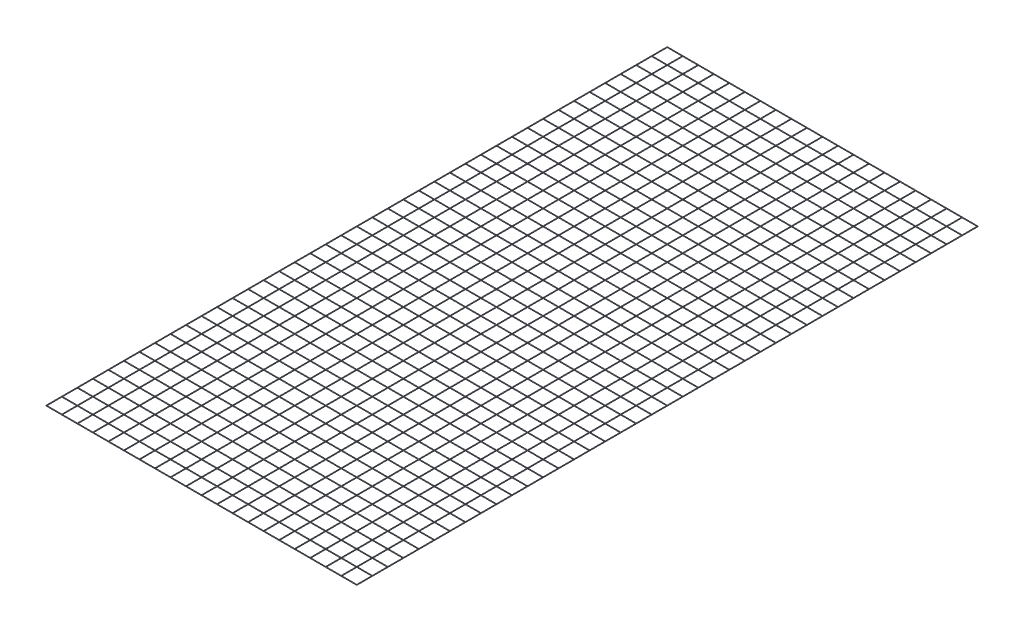
from build123d import *

# Parameters (mm, degrees)
SCHIZZO1_R                      = 1
ESTRUSIONE_ESTRUSIONE1_DEPTH    = 2000
ESTRUSIONE_ESTRUSIONE1_2_DEPTH  = 2000
ESTRUSIONE_ESTRUSIONE1_3_DEPTH  = 2000
ESTRUSIONE_ESTRUSIONE1_4_DEPTH  = 2000
ESTRUSIONE_ESTRUSIONE1_5_DEPTH  = 2000
ESTRUSIONE_ESTRUSIONE1_6_DEPTH  = 2000
ESTRUSIONE_ESTRUSIONE1_7_DEPTH  = 2000
ESTRUSIONE_ESTRUSIONE1_8_DEPTH  = 2000
ESTRUSIONE_ESTRUSIONE1_9_DEPTH  = 2000
ESTRUSIONE_ESTRUSIONE1_10_DEPTH = 2000
ESTRUSIONE_ESTRUSIONE1_11_DEPTH = 2000
ESTRUSIONE_ESTRUSIONE1_12_DEPTH = 2000
ESTRUSIONE_ESTRUSIONE1_13_DEPTH = 2000
ESTRUSIONE_ESTRUSIONE1_14_DEPTH = 2000
ESTRUSIONE_ESTRUSIONE1_15_DEPTH = 2000
ESTRUSIONE_ESTRUSIONE1_16_DEPTH = 2000
ESTRUSIONE_ESTRUSIONE1_17_DEPTH = 2000
ESTRUSIONE_ESTRUSIONE1_18_DEPTH = 2000
ESTRUSIONE_ESTRUSIONE1_19_DEPTH = 2000
ESTRUSIONE_ESTRUSIONE1_20_DEPTH = 2000
ESTRUSIONE_ESTRUSIONE1_21_DEPTH = 2000
SCHIZZO2_R                      = 1
ESTRUSIONE_ESTRUSIONE2_DEPTH    = 1000


with BuildPart() as part:
    # Schizzo1 → Estrusione-Estrusione1 (new body)
    with BuildSketch(Plane.XY):
        Circle(SCHIZZO1_R)
    extrude(amount=ESTRUSIONE_ESTRUSIONE1_DEPTH)


with BuildPart() as body_2:
    # Schizzo1 → Estrusione-Estrusione1 2 (new body)
    with BuildSketch(Plane.XY):
        with Locations((50, 0)):
            Circle(SCHIZZO1_R)
    extrude(amount=ESTRUSIONE_ESTRUSIONE1_2_DEPTH)


with BuildPart() as body_3:
    # Schizzo1 → Estrusione-Estrusione1 3 (new body)
    with BuildSketch(Plane.XY):
        with Locations((100, 0)):
            Circle(SCHIZZO1_R)
    extrude(amount=ESTRUSIONE_ESTRUSIONE1_3_DEPTH)


with BuildPart() as body_4:
    # Schizzo1 → Estrusione-Estrusione1 4 (new body)
    with BuildSketch(Plane.XY):
        with Locations((150, 0)):
            Circle(SCHIZZO1_R)
    extrude(amount=ESTRUSIONE_ESTRUSIONE1_4_DEPTH)


with BuildPart() as body_5:
    # Schizzo1 → Estrusione-Estrusione1 5 (new body)
    with BuildSketch(Plane.XY):
        with Locations((200, 0)):
            Circle(SCHIZZO1_R)
    extrude(amount=ESTRUSIONE_ESTRUSIONE1_5_DEPTH)


with BuildPart() as body_6:
    # Schizzo1 → Estrusione-Estrusione1 6 (new body)
    with BuildSketch(Plane.XY):
        with Locations((250, 0)):
            Circle(SCHIZZO1_R)
    extrude(amount=ESTRUSIONE_ESTRUSIONE1_6_DEPTH)


with BuildPart() as body_7:
    # Schizzo1 → Estrusione-Estrusione1 7 (new body)
    with BuildSketch(Plane.XY):
        with Locations((300, 0)):
            Circle(SCHIZZO1_R)
    extrude(amount=ESTRUSIONE_ESTRUSIONE1_7_DEPTH)


with BuildPart() as body_8:
    # Schizzo1 → Estrusione-Estrusione1 8 (new body)
    with BuildSketch(Plane.XY):
        with Locations((350, 0)):
            Circle(SCHIZZO1_R)
    extrude(amount=ESTRUSIONE_ESTRUSIONE1_8_DEPTH)


with BuildPart() as body_9:
    # Schizzo1 → Estrusione-Estrusione1 9 (new body)
    with BuildSketch(Plane.XY):
        with Locations((400, 0)):
            Circle(SCHIZZO1_R)
    extrude(amount=ESTRUSIONE_ESTRUSIONE1_9_DEPTH)


with BuildPart() as body_10:
    # Schizzo1 → Estrusione-Estrusione1 10 (new body)
    with BuildSketch(Plane.XY):
        with Locations((450, 0)):
            Circle(SCHIZZO1_R)
    extrude(amount=ESTRUSIONE_ESTRUSIONE1_10_DEPTH)


with BuildPart() as body_11:
    # Schizzo1 → Estrusione-Estrusione1 11 (new body)
    with BuildSketch(Plane.XY):
        with Locations((500, 0)):
            Circle(SCHIZZO1_R)
    extrude(amount=ESTRUSIONE_ESTRUSIONE1_11_DEPTH)


with BuildPart() as body_12:
    # Schizzo1 → Estrusione-Estrusione1 12 (new body)
    with BuildSketch(Plane.XY):
        with Locations((550, 0)):
            Circle(SCHIZZO1_R)
    extrude(amount=ESTRUSIONE_ESTRUSIONE1_12_DEPTH)


with BuildPart() as body_13:
    # Schizzo1 → Estrusione-Estrusione1 13 (new body)
    with BuildSketch(Plane.XY):
        with Locations((600, 0)):
            Circle(SCHIZZO1_R)
    extrude(amount=ESTRUSIONE_ESTRUSIONE1_13_DEPTH)


with BuildPart() as body_14:
    # Schizzo1 → Estrusione-Estrusione1 14 (new body)
    with BuildSketch(Plane.XY):
        with Locations((650, 0)):
            Circle(SCHIZZO1_R)
    extrude(amount=ESTRUSIONE_ESTRUSIONE1_14_DEPTH)


with BuildPart() as body_15:
    # Schizzo1 → Estrusione-Estrusione1 15 (new body)
    with BuildSketch(Plane.XY):
        with Locations((700, 0)):
            Circle(SCHIZZO1_R)
    extrude(amount=ESTRUSIONE_ESTRUSIONE1_15_DEPTH)


with BuildPart() as body_16:
    # Schizzo1 → Estrusione-Estrusione1 16 (new body)
    with BuildSketch(Plane.XY):
        with Locations((750, 0)):
            Circle(SCHIZZO1_R)
    extrude(amount=ESTRUSIONE_ESTRUSIONE1_16_DEPTH)


with BuildPart() as body_17:
    # Schizzo1 → Estrusione-Estrusione1 17 (new body)
    with BuildSketch(Plane.XY):
        with Locations((800, 0)):
            Circle(SCHIZZO1_R)
    extrude(amount=ESTRUSIONE_ESTRUSIONE1_17_DEPTH)


with BuildPart() as body_18:
    # Schizzo1 → Estrusione-Estrusione1 18 (new body)
    with BuildSketch(Plane.XY):
        with Locations((850, 0)):
            Circle(SCHIZZO1_R)
    extrude(amount=ESTRUSIONE_ESTRUSIONE1_18_DEPTH)


with BuildPart() as body_19:
    # Schizzo1 → Estrusione-Estrusione1 19 (new body)
    with BuildSketch(Plane.XY):
        with Locations((900, 0)):
            Circle(SCHIZZO1_R)
    extrude(amount=ESTRUSIONE_ESTRUSIONE1_19_DEPTH)


with BuildPart() as body_20:
    # Schizzo1 → Estrusione-Estrusione1 20 (new body)
    with BuildSketch(Plane.XY):
        with Locations((950, 0)):
            Circle(SCHIZZO1_R)
    extrude(amount=ESTRUSIONE_ESTRUSIONE1_20_DEPTH)


with BuildPart() as body_21:
    # Schizzo1 → Estrusione-Estrusione1 21 (new body)
    with BuildSketch(Plane.XY):
        with Locations((1000, 0)):
            Circle(SCHIZZO1_R)
    extrude(amount=ESTRUSIONE_ESTRUSIONE1_21_DEPTH)


with BuildPart() as estrusione_estrusione2_tool:
    # Schizzo2 → Estrusione-Estrusione2 (new body)
    with BuildSketch(Plane(origin=(0, 0, 0), x_dir=(0, 0, -1), z_dir=(1, 0, 0))):
        with Locations(Location((0, 0, 0), (0, 0, 90))):
            Circle(SCHIZZO2_R)
        with Locations(Location((-50, 0, 0), (0, 0, 90))):
            Circle(SCHIZZO2_R)
        with Locations(Location((-100, 0, 0), (0, 0, 270))):
            Circle(SCHIZZO2_R)
        with Locations(Location((-150, 0, 0), (0, 0, 90))):
            Circle(SCHIZZO2_R)
        with Locations(Location((-200, 0, 0), (0, 0, 90))):
            Circle(SCHIZZO2_R)
        with Locations(Location((-250, 0, 0), (0, 0, 90))):
            Circle(SCHIZZO2_R)
        with Locations(Location((-300, 0, 0), (0, 0, 270))):
            Circle(SCHIZZO2_R)
        with Locations(Location((-350, 0, 0), (0, 0, 270))):
            Circle(SCHIZZO2_R)
        with Locations(Location((-400, 0, 0), (0, 0, 270))):
            Circle(SCHIZZO2_R)
        with Locations(Location((-450, 0, 0), (0, 0, 90))):
            Circle(SCHIZZO2_R)
        with Locations(Location((-500, 0, 0), (0, 0, 270))):
            Circle(SCHIZZO2_R)
        with Locations(Location((-550, 0, 0), (0, 0, 90))):
            Circle(SCHIZZO2_R)
        with Locations(Location((-600, 0, 0), (0, 0, 270))):
            Circle(SCHIZZO2_R)
        with Locations(Location((-650, 0, 0), (0, 0, 90))):
            Circle(SCHIZZO2_R)
        with Locations(Location((-700, 0, 0), (0, 0, 90))):
            Circle(SCHIZZO2_R)
        with Locations(Location((-750, 0, 0), (0, 0, 270))):
            Circle(SCHIZZO2_R)
        with Locations(Location((-800, 0, 0), (0, 0, 270))):
            Circle(SCHIZZO2_R)
        with Locations(Location((-850, 0, 0), (0, 0, 270))):
            Circle(SCHIZZO2_R)
        with Locations(Location((-900, 0, 0), (0, 0, 270))):
            Circle(SCHIZZO2_R)
        with Locations(Location((-950, 0, 0), (0, 0, 270))):
            Circle(SCHIZZO2_R)
        with Locations(Location((-1000, 0, 0), (0, 0, 90))):
            Circle(SCHIZZO2_R)
        with Locations(Location((-1050, 0, 0), (0, 0, 90))):
            Circle(SCHIZZO2_R)
        with Locations(Location((-1100, 0, 0), (0, 0, 270))):
            Circle(SCHIZZO2_R)
        with Locations(Location((-1150, 0, 0), (0, 0, 90))):
            Circle(SCHIZZO2_R)
        with Locations(Location((-1200, 0, 0), (0, 0, 270))):
            Circle(SCHIZZO2_R)
        with Locations(Location((-1250, 0, 0), (0, 0, 270))):
            Circle(SCHIZZO2_R)
        with Locations(Location((-1300, 0, 0), (0, 0, 90))):
            Circle(SCHIZZO2_R)
        with Locations(Location((-1350, 0, 0), (0, 0, 270))):
            Circle(SCHIZZO2_R)
        with Locations(Location((-1400, 0, 0), (0, 0, 90))):
            Circle(SCHIZZO2_R)
        with Locations(Location((-1450, 0, 0), (0, 0, 270))):
            Circle(SCHIZZO2_R)
        with Locations(Location((-1500, 0, 0), (0, 0, 270))):
            Circle(SCHIZZO2_R)
        with Locations(Location((-1550, 0, 0), (0, 0, 270))):
            Circle(SCHIZZO2_R)
        with Locations(Location((-1600, 0, 0), (0, 0, 270))):
            Circle(SCHIZZO2_R)
        with Locations(Location((-1650, 0, 0), (0, 0, 270))):
            Circle(SCHIZZO2_R)
        with Locations(Location((-1700, 0, 0), (0, 0, 270))):
            Circle(SCHIZZO2_R)
        with Locations(Location((-1750, 0, 0), (0, 0, 270))):
            Circle(SCHIZZO2_R)
        with Locations(Location((-1800, 0, 0), (0, 0, 270))):
            Circle(SCHIZZO2_R)
        with Locations(Location((-1850, 0, 0), (0, 0, 270))):
            Circle(SCHIZZO2_R)
        with Locations(Location((-1900, 0, 0), (0, 0, 270))):
            Circle(SCHIZZO2_R)
        with Locations(Location((-1950, 0, 0), (0, 0, 90))):
            Circle(SCHIZZO2_R)
        with Locations(Location((-2000, 0, 0), (0, 0, 270))):
            Circle(SCHIZZO2_R)
    extrude(amount=ESTRUSIONE_ESTRUSIONE2_DEPTH)


with BuildPart() as part_1:
    add(part.part)


with BuildPart() as part_2:
    # Estrusione-Estrusione2: joined with estrusione_estrusione2_tool
    add(part_1.part.fuse(estrusione_estrusione2_tool.part, body_2.part, body_3.part, body_4.part, body_5.part, body_6.part, body_7.part, body_8.part, body_9.part, body_10.part, body_11.part, body_12.part, body_13.part, body_14.part, body_15.part, body_16.part, body_17.part, body_18.part, body_19.part, body_20.part, tol=0.00001))


solid = Compound([body_21.part, part_2.part])
